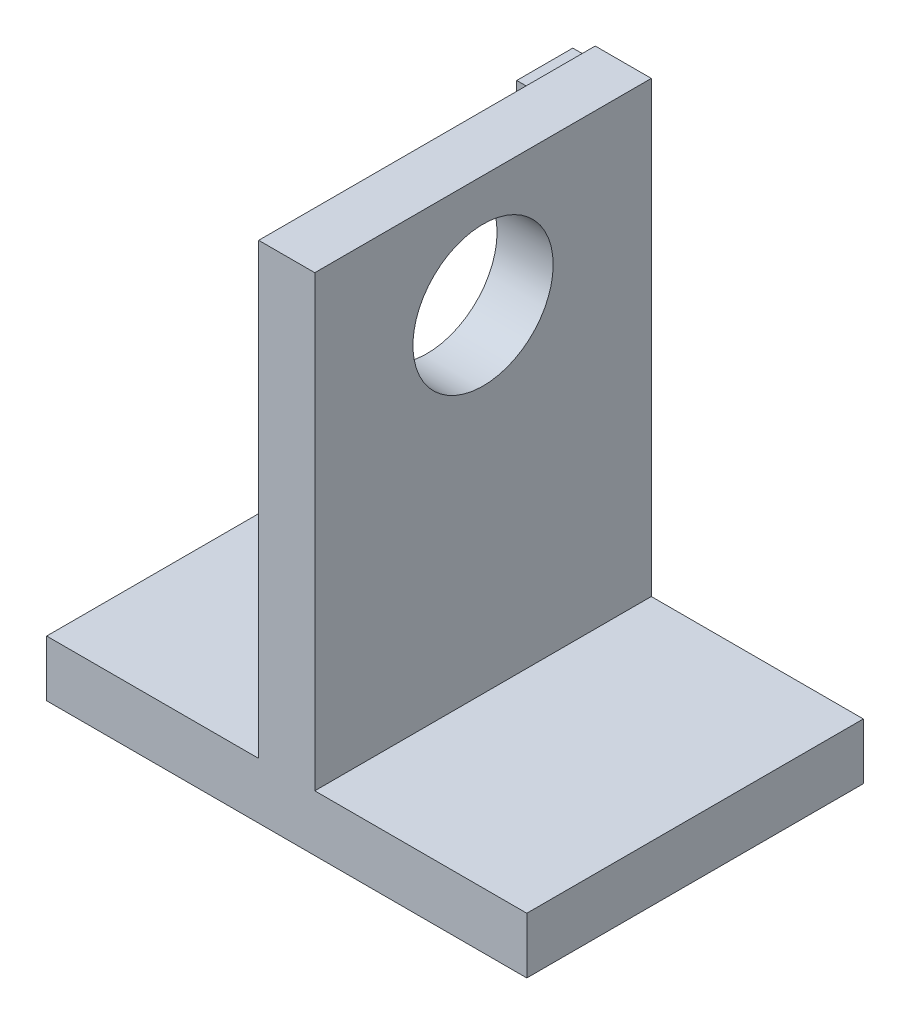
from build123d import *

# Parameters (mm, degrees)
BOSS_EXTRUDE1_DEPTH     = 19.05
CUT_EXTRUDE1_DEPTH      = 65.788175881
CUT_EXTRUDE1_DEPTH_BACK = 65.788175881
SKETCH2_R               = 7.9375
SKETCH3_W               = 6.35
SKETCH3_H               = 6.35
BOSS_EXTRUDE2_DEPTH     = 2.54
FILLET1_R               = 6.35
SKETCH4_W               = 6.35
SKETCH4_H               = 0.8636
BOSS_EXTRUDE3_DEPTH     = 1.016


with BuildPart() as part:
    # Sketch1 → Boss-Extrude1 (new, symmetric)
    with BuildSketch(Plane.XY):
        Polygon((-1.397, 3.175), (-1.397, 53.975), (4.953, 53.975), (4.953, 3.175), (28.956, 3.175), (28.956, -3.175), (-25.4, -3.175), (-25.4, 3.175), align=None)
    extrude(amount=BOSS_EXTRUDE1_DEPTH, both=True)

    # Sketch2 → Cut-Extrude1 (cut, two sides: drawn at the far end of the back side and taken through both)
    with BuildSketch(Plane(origin=(4.953, 0, 0), x_dir=(0, 0, -1), z_dir=(1, 0, 0)).offset(-CUT_EXTRUDE1_DEPTH_BACK)):
        with Locations((0, 41.275)):
            Circle(SKETCH2_R)
    extrude(amount=CUT_EXTRUDE1_DEPTH + CUT_EXTRUDE1_DEPTH_BACK, mode=Mode.SUBTRACT)

    # Sketch3 → Boss-Extrude2 (add)
    with BuildSketch(Plane.ZY.offset(1.397)):
        with Locations((-15.875, 49.3268)):
            Rectangle(SKETCH3_W, SKETCH3_H)
        with Locations((-15.875, 42.1132)):
            Rectangle(SKETCH3_W, SKETCH3_H)
    extrude(amount=BOSS_EXTRUDE2_DEPTH)

    # Fillet1
    # the kernel refuses this fillet: 6.35 mm, written as the material it adds along each edge
    with BuildSketch(Plane(origin=(-1.397, 38.9382, -19.05), x_dir=(0, -1, 0), z_dir=(0, 0, 1))) as fillet1_piece_1:
        with BuildLine():
            CenterArc((5.08, -6.35), FILLET1_R, 90, 53.130102354)
            Line((0, -2.54), (-0.1016, -2.4638))
            ThreePointArc((-0.1016, -2.4638), (-0.127, -1.27), (-0.127, 0))
            Line((-0.127, 0), (0, 0.127))
            Line((0, 0.127), (5.08, 0.127))
            Line((5.08, 0.127), (5.08, 0))
        make_face()
    extrude(amount=6.35)

    # Sketch4 → Boss-Extrude3 (add)
    with BuildSketch(Plane.ZY.offset(1.397)):
        with Locations((-15.875, 45.72)):
            Rectangle(SKETCH4_W, SKETCH4_H)
    extrude(amount=BOSS_EXTRUDE3_DEPTH)


solid = part.part
